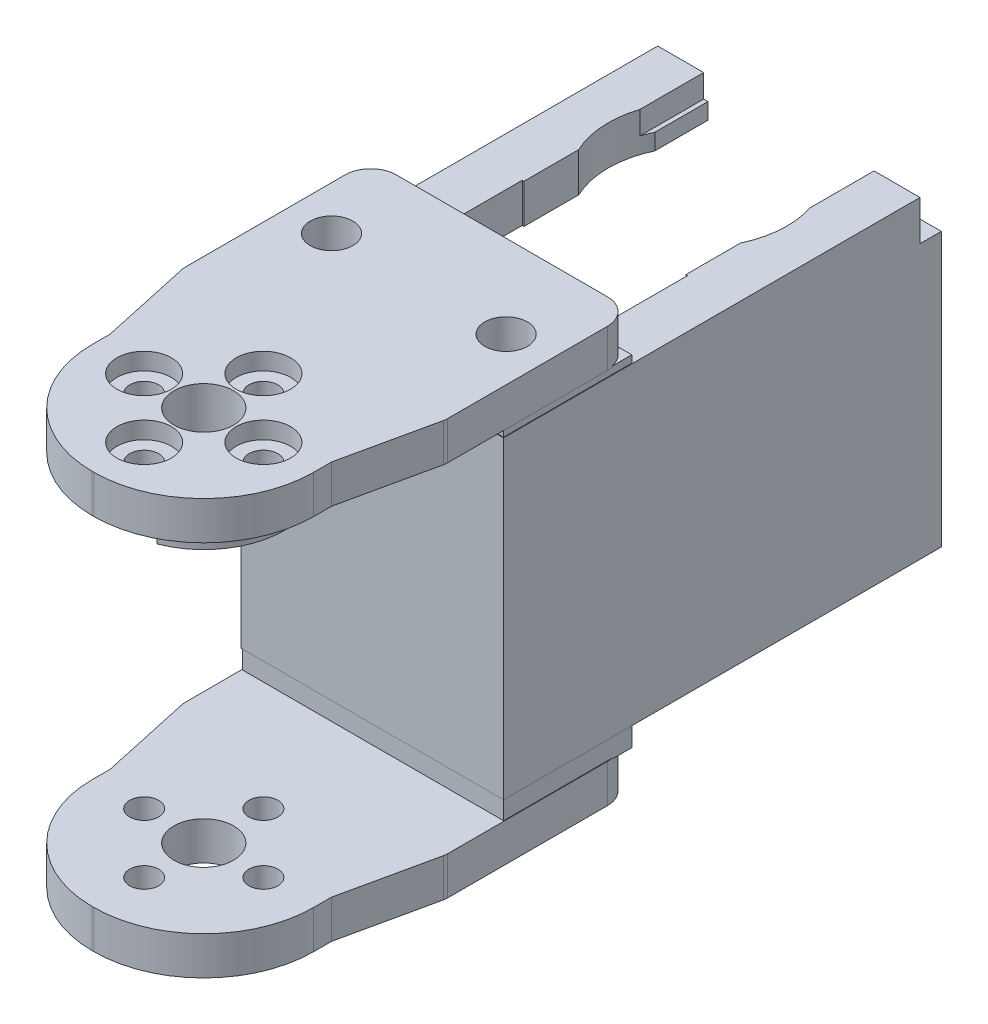
from build123d import *

# Parameters (mm, degrees)
BOSS_1_DEPTH    = 4.5
S_CYL2_R        = 9.5
BOSS_2_DEPTH    = 3.2
BOSS_3_DEPTH    = 4.5
S_BOX4_W        = 30.8
S_BOX4_H        = 36.8
BOSS_4_DEPTH    = 2.5
S_BOX5_W        = 2.5
S_BOX5_H        = 36.8
BOSS_5_DEPTH    = 51.4
S_BOX6_W        = 30.8
S_BOX6_H        = 4.6
BOSS_6_DEPTH    = 51.4
S_BOX7_W        = 2.5
S_BOX7_H        = 36.8
BOSS_7_DEPTH    = 28.2
S_BOX8_W        = 30.66
S_BOX8_H        = 2.4
BOSS_8_DEPTH    = 15.06
S_BOX9_W        = 30.66
S_BOX9_H        = 0.95
BOSS_9_DEPTH    = 15.06
S_HOLE10_R      = 3.5
HOLE_10_DEPTH   = 4.7
S_HOLE11_R      = 1.7
HOLE_11_DEPTH   = 4.7
S_HOLE12_R      = 1.7
HOLE_12_DEPTH   = 4.7
S_HOLE13_R      = 1.7
HOLE_13_DEPTH   = 4.7
S_HOLE14_R      = 1.7
HOLE_14_DEPTH   = 4.7
S_HOLE15_R      = 3.2
HOLE_15_DEPTH   = 1.6
S_HOLE16_R      = 3.2
HOLE_16_DEPTH   = 1.6
S_HOLE17_R      = 3.2
HOLE_17_DEPTH   = 1.6
S_HOLE18_R      = 3.2
HOLE_18_DEPTH   = 1.6
S_HOLE19_R      = 3.5
HOLE_19_DEPTH   = 7.9
S_HOLE20_R      = 1.7
HOLE_20_DEPTH   = 7.9
S_HOLE21_R      = 1.7
HOLE_21_DEPTH   = 7.9
S_HOLE22_R      = 1.7
HOLE_22_DEPTH   = 7.9
S_HOLE23_R      = 1.7
HOLE_23_DEPTH   = 7.9
S_HOLE24_R      = 3.2
HOLE_24_DEPTH   = 2.1
S_HOLE25_R      = 3.2
HOLE_25_DEPTH   = 2.1
S_HOLE26_R      = 3.2
HOLE_26_DEPTH   = 2.1
S_HOLE27_R      = 3.2
HOLE_27_DEPTH   = 2.1
S_CUT28_W       = 6.8
S_CUT28_H       = 1
POCKET_28_DEPTH = 10
S_HOLE29_R      = 10.5
HOLE_29_DEPTH   = 4.8
S_CUT30_W       = 19.4
S_CUT30_H       = 4.75
POCKET_30_DEPTH = 19.5
S_CUT31_W       = 16.4
S_CUT31_H       = 4.75
POCKET_31_DEPTH = 8.3
S_CUT32_W       = 7
S_CUT32_H       = 4.75
POCKET_32_DEPTH = 11
S_CUT33_W       = 20
S_CUT33_H       = 2.9
POCKET_33_DEPTH = 13.7
S_HOLE34_R      = 1.1
HOLE_34_DEPTH   = 4.8
S_HOLE35_R      = 2.3
HOLE_35_DEPTH   = 1.7
S_HOLE36_R      = 1.1
HOLE_36_DEPTH   = 4.8
S_HOLE37_R      = 2.3
HOLE_37_DEPTH   = 1.7
S_CUT38_W       = 31
S_CUT38_H       = 4.8
POCKET_38_DEPTH = 2.6
S_CUT39_W       = 19
S_CUT39_H       = 4.75
POCKET_39_DEPTH = 22.2
S_CUT40_W       = 15
S_CUT40_H       = 1.55
POCKET_40_DEPTH = 27.4
S_HOLE41_R      = 2.5
HOLE_41_DEPTH   = 5.3
S_HOLE42_R      = 2.5
HOLE_42_DEPTH   = 5.3


with BuildPart() as part:
    # S_prism1 → Boss_1 (new body)
    with BuildSketch(Plane(origin=(0, -23.3, 0), x_dir=(1, 0, 0), z_dir=(0, 1, 0))):
        with BuildLine():
            Line((-13, 2), (-15.354, 12.7893))
            ThreePointArc((-15.354, 12.7893), (-15.38850097, 13.001208985), (-15.4, 13.2156))
            Line((-15.4, 13.2156), (-15.4, 32))
            ThreePointArc((-15.4, 32), (-14.5213, 34.1213), (-12.4, 35))
            Line((-12.4, 35), (12.4, 35))
            ThreePointArc((12.4, 35), (14.5213, 34.1213), (15.4, 32))
            Line((15.4, 32), (15.4, 13.2156))
            ThreePointArc((15.4, 13.2156), (15.38850097, 13.001208985), (15.354, 12.7893))
            Line((15.354, 12.7893), (13, 2))
            Line((13, 2), (13, -0.1))
            ThreePointArc((13, -0.1), (9.2217, -9.2217), (0.1, -13))
            Line((0.1, -13), (-0.1, -13))
            ThreePointArc((-0.1, -13), (-9.2217, -9.2217), (-13, -0.1))
            Line((-13, -0.1), (-13, 2))
        make_face()
    extrude(amount=BOSS_1_DEPTH)



with BuildPart() as body_2:
    # S_cyl2 → Boss_2 (new body)
    with BuildSketch(Plane(origin=(0, 17.75, 0), x_dir=(1, 0, 0), z_dir=(0, 1, 0))):
        Circle(S_CYL2_R)
    extrude(amount=BOSS_2_DEPTH)

    # S_prism3 → Boss_3 (add)
    with BuildSketch(Plane(origin=(0, 20.95, 0), x_dir=(1, 0, 0), z_dir=(0, 1, 0))):
        with BuildLine():
            Line((-13, 2), (-15.354, 12.7893))
            ThreePointArc((-15.354, 12.7893), (-15.38850097, 13.001208985), (-15.4, 13.2156))
            Line((-15.4, 13.2156), (-15.4, 32))
            ThreePointArc((-15.4, 32), (-14.5213, 34.1213), (-12.4, 35))
            Line((-12.4, 35), (12.4, 35))
            ThreePointArc((12.4, 35), (14.5213, 34.1213), (15.4, 32))
            Line((15.4, 32), (15.4, 13.2156))
            ThreePointArc((15.4, 13.2156), (15.38850097, 13.001208985), (15.354, 12.7893))
            Line((15.354, 12.7893), (13, 2))
            Line((13, 2), (13, -0.1))
            ThreePointArc((13, -0.1), (9.2217, -9.2217), (0.1, -13))
            Line((0.1, -13), (-0.1, -13))
            ThreePointArc((-0.1, -13), (-9.2217, -9.2217), (-13, -0.1))
            Line((-13, -0.1), (-13, 2))
        make_face()
    extrude(amount=BOSS_3_DEPTH)


with BuildPart() as body_3:
    # S_box4 → Boss_4 (new body)
    with BuildSketch(Plane.XY.offset(-22.3)):
        with Locations((0, 1.8)):
            Rectangle(S_BOX4_W, S_BOX4_H)
    extrude(amount=BOSS_4_DEPTH)

    # S_box5 → Boss_5 (add)
    with BuildSketch(Plane.XY.offset(-71.2)):
        with Locations((14.15, 1.8)):
            Rectangle(S_BOX5_W, S_BOX5_H)
    extrude(amount=BOSS_5_DEPTH)

    # S_box6 → Boss_6 (add)
    with BuildSketch(Plane.XY.offset(-71.2)):
        with Locations((0, 17.9)):
            Rectangle(S_BOX6_W, S_BOX6_H)
    extrude(amount=BOSS_6_DEPTH)

    # S_box7 → Boss_7 (add)
    with BuildSketch(Plane.XY.offset(-48)):
        with Locations((-14.15, 1.8)):
            Rectangle(S_BOX7_W, S_BOX7_H)
    extrude(amount=BOSS_7_DEPTH)


with BuildPart() as part_1:
    add(part.part)

    add(body_3.part)  # Boss_8 merges body 3
    # S_box8 → Boss_8 (add)
    with BuildSketch(Plane.XY.offset(-34.93)):
        with Locations((0, -17.7)):
            Rectangle(S_BOX8_W, S_BOX8_H)
    extrude(amount=BOSS_8_DEPTH)


    add(body_2.part)  # Boss_9 merges body 2
    # S_box9 → Boss_9 (add)
    with BuildSketch(Plane.XY.offset(-34.93)):
        with Locations((0, 20.575)):
            Rectangle(S_BOX9_W, S_BOX9_H)
    extrude(amount=BOSS_9_DEPTH)

    # S_hole10 → Hole_10 (cut)
    with BuildSketch(Plane(origin=(0, -23.4, 0), x_dir=(1, 0, 0), z_dir=(0, 1, 0))):
        Circle(S_HOLE10_R)
    extrude(amount=HOLE_10_DEPTH, mode=Mode.SUBTRACT)

    # S_hole11 → Hole_11 (cut)
    with BuildSketch(Plane(origin=(0, -23.4, 0), x_dir=(1, 0, 0), z_dir=(0, 1, 0))):
        with Locations((7, 0)):
            Circle(S_HOLE11_R)
    extrude(amount=HOLE_11_DEPTH, mode=Mode.SUBTRACT)

    # S_hole12 → Hole_12 (cut)
    with BuildSketch(Plane(origin=(0, -23.4, 0), x_dir=(1, 0, 0), z_dir=(0, 1, 0))):
        with Locations((0, -7)):
            Circle(S_HOLE12_R)
    extrude(amount=HOLE_12_DEPTH, mode=Mode.SUBTRACT)

    # S_hole13 → Hole_13 (cut)
    with BuildSketch(Plane(origin=(0, -23.4, 0), x_dir=(1, 0, 0), z_dir=(0, 1, 0))):
        with Locations((-7, 0)):
            Circle(S_HOLE13_R)
    extrude(amount=HOLE_13_DEPTH, mode=Mode.SUBTRACT)

    # S_hole14 → Hole_14 (cut)
    with BuildSketch(Plane(origin=(0, -23.4, 0), x_dir=(1, 0, 0), z_dir=(0, 1, 0))):
        with Locations((0, 7)):
            Circle(S_HOLE14_R)
    extrude(amount=HOLE_14_DEPTH, mode=Mode.SUBTRACT)

    # S_hole15 → Hole_15 (cut)
    with BuildSketch(Plane(origin=(0, -23.4, 0), x_dir=(1, 0, 0), z_dir=(0, 1, 0))):
        with Locations((7, 0)):
            Circle(S_HOLE15_R)
    extrude(amount=HOLE_15_DEPTH, mode=Mode.SUBTRACT)

    # S_hole16 → Hole_16 (cut)
    with BuildSketch(Plane(origin=(0, -23.4, 0), x_dir=(1, 0, 0), z_dir=(0, 1, 0))):
        with Locations((0, -7)):
            Circle(S_HOLE16_R)
    extrude(amount=HOLE_16_DEPTH, mode=Mode.SUBTRACT)

    # S_hole17 → Hole_17 (cut)
    with BuildSketch(Plane(origin=(0, -23.4, 0), x_dir=(1, 0, 0), z_dir=(0, 1, 0))):
        with Locations((-7, 0)):
            Circle(S_HOLE17_R)
    extrude(amount=HOLE_17_DEPTH, mode=Mode.SUBTRACT)

    # S_hole18 → Hole_18 (cut)
    with BuildSketch(Plane(origin=(0, -23.4, 0), x_dir=(1, 0, 0), z_dir=(0, 1, 0))):
        with Locations((0, 7)):
            Circle(S_HOLE18_R)
    extrude(amount=HOLE_18_DEPTH, mode=Mode.SUBTRACT)

    # S_hole19 → Hole_19 (cut)
    with BuildSketch(Plane(origin=(0, 17.65, 0), x_dir=(1, 0, 0), z_dir=(0, 1, 0))):
        Circle(S_HOLE19_R)
    extrude(amount=HOLE_19_DEPTH, mode=Mode.SUBTRACT)

    # S_hole20 → Hole_20 (cut)
    with BuildSketch(Plane(origin=(0, 17.65, 0), x_dir=(1, 0, 0), z_dir=(0, 1, 0))):
        with Locations((7, 0)):
            Circle(S_HOLE20_R)
    extrude(amount=HOLE_20_DEPTH, mode=Mode.SUBTRACT)

    # S_hole21 → Hole_21 (cut)
    with BuildSketch(Plane(origin=(0, 17.65, 0), x_dir=(1, 0, 0), z_dir=(0, 1, 0))):
        with Locations((0, -7)):
            Circle(S_HOLE21_R)
    extrude(amount=HOLE_21_DEPTH, mode=Mode.SUBTRACT)

    # S_hole22 → Hole_22 (cut)
    with BuildSketch(Plane(origin=(0, 17.65, 0), x_dir=(1, 0, 0), z_dir=(0, 1, 0))):
        with Locations((-7, 0)):
            Circle(S_HOLE22_R)
    extrude(amount=HOLE_22_DEPTH, mode=Mode.SUBTRACT)

    # S_hole23 → Hole_23 (cut)
    with BuildSketch(Plane(origin=(0, 17.65, 0), x_dir=(1, 0, 0), z_dir=(0, 1, 0))):
        with Locations((0, 7)):
            Circle(S_HOLE23_R)
    extrude(amount=HOLE_23_DEPTH, mode=Mode.SUBTRACT)

    # S_hole24 → Hole_24 (cut)
    with BuildSketch(Plane(origin=(0, 23.45, 0), x_dir=(1, 0, 0), z_dir=(0, 1, 0))):
        with Locations((7, 0)):
            Circle(S_HOLE24_R)
    extrude(amount=HOLE_24_DEPTH, mode=Mode.SUBTRACT)

    # S_hole25 → Hole_25 (cut)
    with BuildSketch(Plane(origin=(0, 23.45, 0), x_dir=(1, 0, 0), z_dir=(0, 1, 0))):
        with Locations((0, -7)):
            Circle(S_HOLE25_R)
    extrude(amount=HOLE_25_DEPTH, mode=Mode.SUBTRACT)

    # S_hole26 → Hole_26 (cut)
    with BuildSketch(Plane(origin=(0, 23.45, 0), x_dir=(1, 0, 0), z_dir=(0, 1, 0))):
        with Locations((-7, 0)):
            Circle(S_HOLE26_R)
    extrude(amount=HOLE_26_DEPTH, mode=Mode.SUBTRACT)

    # S_hole27 → Hole_27 (cut)
    with BuildSketch(Plane(origin=(0, 23.45, 0), x_dir=(1, 0, 0), z_dir=(0, 1, 0))):
        with Locations((0, 7)):
            Circle(S_HOLE27_R)
    extrude(amount=HOLE_27_DEPTH, mode=Mode.SUBTRACT)

    # S_cut28 → Pocket_28 (cut)
    with BuildSketch(Plane.XY):
        with Locations((0, 18.15)):
            Rectangle(S_CUT28_W, S_CUT28_H)
    extrude(amount=POCKET_28_DEPTH, mode=Mode.SUBTRACT)

    # S_hole29 → Hole_29 (cut)
    with BuildSketch(Plane(origin=(0, 15.5, 0), x_dir=(1, 0, 0), z_dir=(0, 1, 0))):
        with Locations((0, 58)):
            Circle(S_HOLE29_R)
    extrude(amount=HOLE_29_DEPTH, mode=Mode.SUBTRACT)

    # S_cut30 → Pocket_30 (cut)
    with BuildSketch(Plane.XY.offset(-47.1)):
        with Locations((0, 17.925)):
            Rectangle(S_CUT30_W, S_CUT30_H)
    extrude(amount=POCKET_30_DEPTH, mode=Mode.SUBTRACT)

    # S_cut31 → Pocket_31 (cut)
    with BuildSketch(Plane.XY.offset(-27.6)):
        with Locations((0, 17.925)):
            Rectangle(S_CUT31_W, S_CUT31_H)
    extrude(amount=POCKET_31_DEPTH, mode=Mode.SUBTRACT)

    # S_cut32 → Pocket_32 (cut)
    with BuildSketch(Plane.XY.offset(-58)):
        with Locations((0, 17.925)):
            Rectangle(S_CUT32_W, S_CUT32_H)
    extrude(amount=POCKET_32_DEPTH, mode=Mode.SUBTRACT)

    # S_cut33 → Pocket_33 (cut)
    with BuildSketch(Plane.XY.offset(-71.7)):
        with Locations((0, 18.95)):
            Rectangle(S_CUT33_W, S_CUT33_H)
    extrude(amount=POCKET_33_DEPTH, mode=Mode.SUBTRACT)

    # S_hole34 → Hole_34 (cut)
    with BuildSketch(Plane(origin=(0, 15.5, 0), x_dir=(1, 0, 0), z_dir=(0, 1, 0))):
        with Locations((-10.25, 25.25)):
            Circle(S_HOLE34_R)
    extrude(amount=HOLE_34_DEPTH, mode=Mode.SUBTRACT)

    # S_hole35 → Hole_35 (cut)
    with BuildSketch(Plane(origin=(0, 18.6, 0), x_dir=(1, 0, 0), z_dir=(0, 1, 0))):
        with Locations((-10.25, 25.25)):
            Circle(S_HOLE35_R)
    extrude(amount=HOLE_35_DEPTH, mode=Mode.SUBTRACT)

    # S_hole36 → Hole_36 (cut)
    with BuildSketch(Plane(origin=(0, 15.5, 0), x_dir=(1, 0, 0), z_dir=(0, 1, 0))):
        with Locations((10.25, 25.25)):
            Circle(S_HOLE36_R)
    extrude(amount=HOLE_36_DEPTH, mode=Mode.SUBTRACT)

    # S_hole37 → Hole_37 (cut)
    with BuildSketch(Plane(origin=(0, 18.6, 0), x_dir=(1, 0, 0), z_dir=(0, 1, 0))):
        with Locations((10.25, 25.25)):
            Circle(S_HOLE37_R)
    extrude(amount=HOLE_37_DEPTH, mode=Mode.SUBTRACT)

    # S_cut38 → Pocket_38 (cut)
    with BuildSketch(Plane.XY.offset(-71.3)):
        with Locations((0, 17.9)):
            Rectangle(S_CUT38_W, S_CUT38_H)
    extrude(amount=POCKET_38_DEPTH, mode=Mode.SUBTRACT)

    # S_cut39 → Pocket_39 (cut)
    with BuildSketch(Plane.XY.offset(-68.8)):
        with Locations((0, 17.925)):
            Rectangle(S_CUT39_W, S_CUT39_H)
    extrude(amount=POCKET_39_DEPTH, mode=Mode.SUBTRACT)

    # S_cut40 → Pocket_40 (cut)
    with BuildSketch(Plane.XY.offset(-49.9)):
        with Locations((0, -16.975)):
            Rectangle(S_CUT40_W, S_CUT40_H)
    extrude(amount=POCKET_40_DEPTH, mode=Mode.SUBTRACT)

    # S_hole41 → Hole_41 (cut)
    with BuildSketch(Plane(origin=(0, 20.25, 0), x_dir=(1, 0, 0), z_dir=(0, 1, 0))):
        with Locations((-10.25, 25.25)):
            Circle(S_HOLE41_R)
    extrude(amount=HOLE_41_DEPTH, mode=Mode.SUBTRACT)

    # S_hole42 → Hole_42 (cut)
    with BuildSketch(Plane(origin=(0, 20.25, 0), x_dir=(1, 0, 0), z_dir=(0, 1, 0))):
        with Locations((10.25, 25.25)):
            Circle(S_HOLE42_R)
    extrude(amount=HOLE_42_DEPTH, mode=Mode.SUBTRACT)


solid = part_1.part
